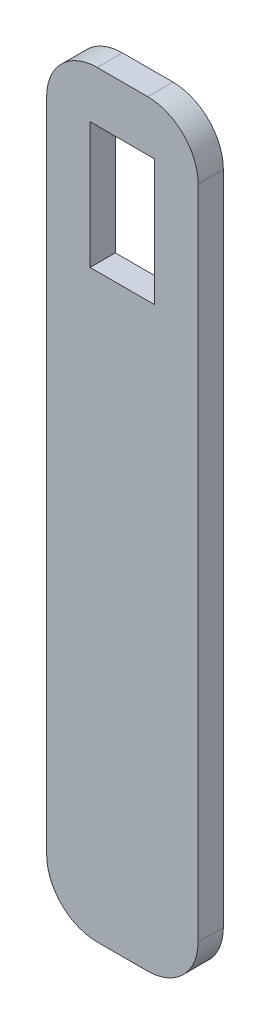
from build123d import *

# Parameters (mm, degrees)
SKICA1_W                 = 30
SKICA1_H                 = 150
P_IDAT_VYSUNUT_M1_DEPTH  = 5
ZAOBLIT1_R               = 10
SKICA2_W                 = 12.8
SKICA2_H                 = 25
ODEBRAT_VYSUNUT_M1_DEPTH = 154.05227865


with BuildPart() as part:
    # Skica1 → Přidat vysunutím1 (new body)
    with BuildSketch(Plane.XY):
        with Locations((15, 75)):
            Rectangle(SKICA1_W, SKICA1_H)
    extrude(amount=P_IDAT_VYSUNUT_M1_DEPTH)

    # Zaoblit1
    zaoblit1_edges = [part.edges().sort_by_distance(p)[0] for p in [
        (30, 0, 2.5),
        (0, 0, 2.5),
        (30, 150, 2.5),
        (0, 150, 2.5),
    ]]
    fillet(zaoblit1_edges, radius=ZAOBLIT1_R)

    # Skica2 → Odebrat vysunutím1 (cut, through all)
    with BuildSketch(Plane.XY.offset(5)):
        with Locations((15, 127.5)):
            Rectangle(SKICA2_W, SKICA2_H)
    extrude(amount=-ODEBRAT_VYSUNUT_M1_DEPTH, mode=Mode.SUBTRACT)


solid = part.part
